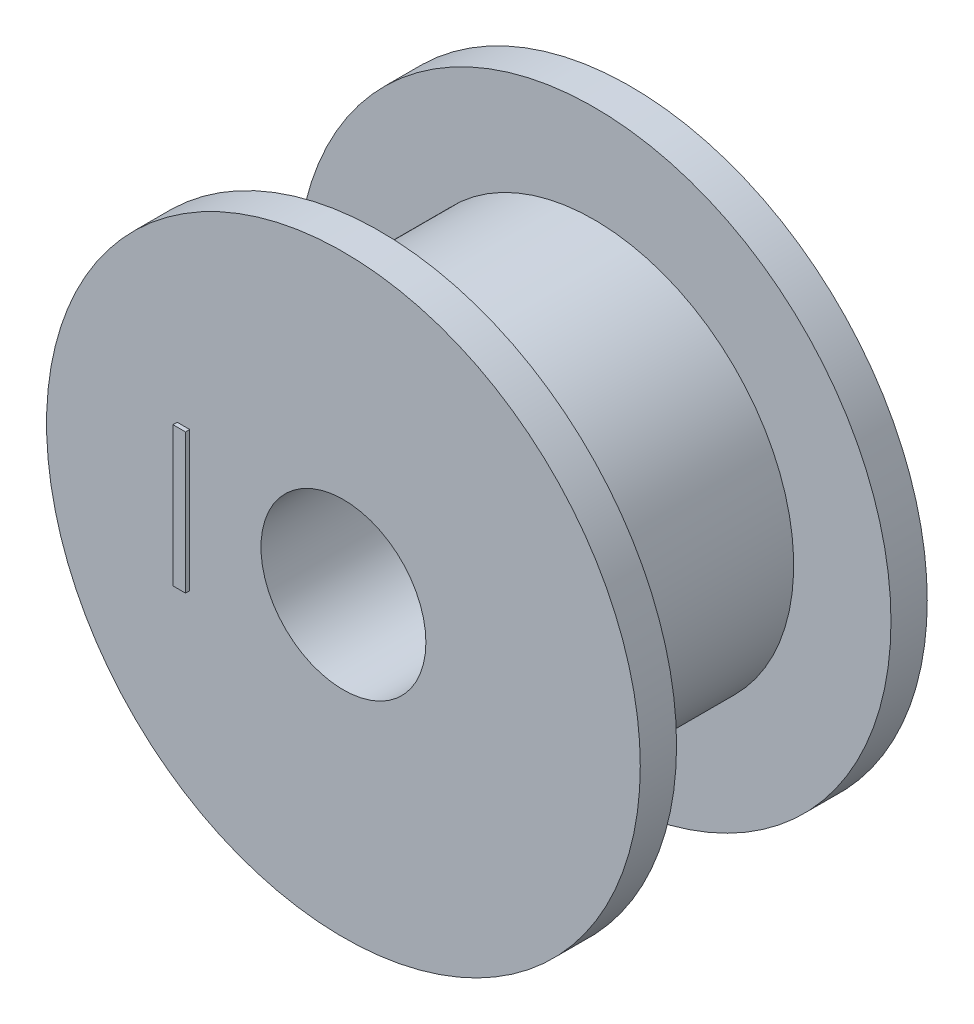
from build123d import *

# Parameters (mm, degrees)
SKETCH1_R           = 9
BOSS_EXTRUDE1_DEPTH = 1.1
SKETCH2_R           = 6.05
BOSS_EXTRUDE2_DEPTH = 6.5
SKETCH3_R           = 9
BOSS_EXTRUDE3_DEPTH = 1.1
CUT_EXTRUDE1_REACH  = 17.417
SKETCH4_R           = 2.5
SKETCH5_W           = 0.37991453
SKETCH5_H           = 4.233333334
BOSS_EXTRUDE4_DEPTH = 0.127


with BuildPart() as part:
    # Sketch1 → Boss-Extrude1 (new body)
    with BuildSketch(Plane.XY):
        Circle(SKETCH1_R)
    extrude(amount=BOSS_EXTRUDE1_DEPTH)

    # Sketch2 → Boss-Extrude2 (add)
    with BuildSketch(Plane.XY.offset(1.1)):
        Circle(SKETCH2_R)
    extrude(amount=BOSS_EXTRUDE2_DEPTH)

    # Sketch3 → Boss-Extrude3 (add)
    with BuildSketch(Plane.XY.offset(7.6)):
        Circle(SKETCH3_R)
    extrude(amount=BOSS_EXTRUDE3_DEPTH)

    # Sketch4 → Cut-Extrude1 (cut, up to next)
    with BuildSketch(Plane.XY.offset(8.7), mode=Mode.PRIVATE) as cut_extrude1_sk1:
        Circle(SKETCH4_R)
    cut_extrude1_tool1 = extrude(cut_extrude1_sk1.sketch, amount=-CUT_EXTRUDE1_REACH, mode=Mode.PRIVATE) & part.part
    add(cut_extrude1_tool1.solids().sort_by_distance((0, 0, 8.7))[0], mode=Mode.SUBTRACT)

    # Sketch5 → Boss-Extrude4 (add)
    with BuildSketch(Plane.XY.offset(8.7)):
        with Locations((-4.850266592, -0.107968693)):
            Rectangle(SKETCH5_W, SKETCH5_H)
    extrude(amount=BOSS_EXTRUDE4_DEPTH)


solid = part.part
